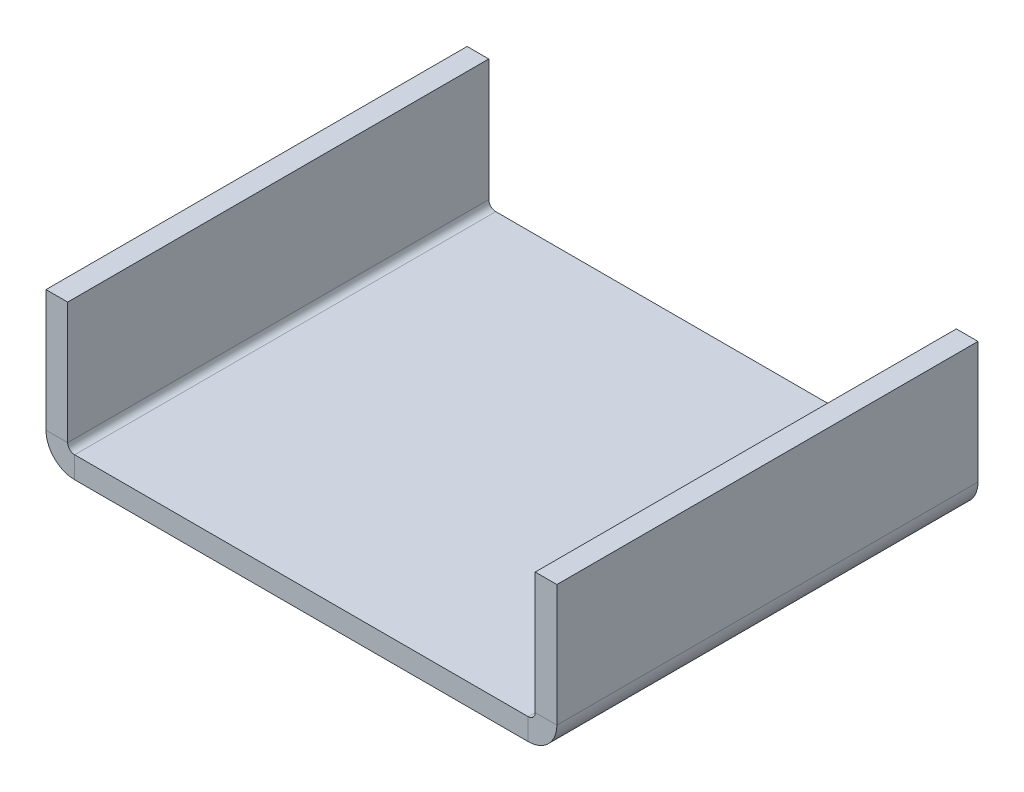
from build123d import *

# Parameters (mm, degrees)
SKETCH1_W                      = 53.9242
SKETCH1_H                      = 44.45
BASE_FLANGE2_DEPTH             = 2.286
EDGE_FLANGE1_STRIP_W           = 10.6172
EDGE_FLANGE1_STRIP_H           = 2.286
EDGE_FLANGE1_STRIP_CUT_DEPTH   = 44.45
EDGE_FLANGE1_STRIP_2_W         = 10.6172
EDGE_FLANGE1_STRIP_2_H         = 2.286
EDGE_FLANGE1_STRIP_CUT_2_DEPTH = 44.45
EDGE_FLANGE1_DEPTH             = 44.45
EDGE_FLANGE1_BEND_DEPTH        = 44.45


# Sheet-metal steps are written as plain solids
with BuildPart() as part:
    # Sketch1 → Base-Flange2 (new body)
    with BuildSketch(Plane(origin=(0, 0, 0), x_dir=(1, 0, 0), z_dir=(0, 1, 0))):
        Rectangle(SKETCH1_W, SKETCH1_H)
    extrude(amount=-BASE_FLANGE2_DEPTH)

    # Edge-Flange1 strip (across the edge) → Edge-Flange1 strip cut (cut)
    with BuildSketch(Plane(origin=(-26.9621, 0, -22.225), x_dir=(1, 0, 0), z_dir=(0, 0, 1))):
        with Locations((-2.286, -1.143)):
            Rectangle(EDGE_FLANGE1_STRIP_W, EDGE_FLANGE1_STRIP_H)
    extrude(amount=EDGE_FLANGE1_STRIP_CUT_DEPTH, mode=Mode.SUBTRACT)

    # Edge-Flange1 strip 2 (across the edge) → Edge-Flange1 strip cut 2 (cut)
    with BuildSketch(Plane(origin=(26.9621, 0, 22.225), x_dir=(-1, 0, 0), z_dir=(0, 0, -1))):
        with Locations((-2.286, -1.143)):
            Rectangle(EDGE_FLANGE1_STRIP_2_W, EDGE_FLANGE1_STRIP_2_H)
    extrude(amount=EDGE_FLANGE1_STRIP_CUT_2_DEPTH, mode=Mode.SUBTRACT)

    # Edge-Flange1 section (across the edge) → Edge-Flange1 (add)
    with BuildSketch(Plane(origin=(-26.9621, 0, -22.225), x_dir=(1, 0, 0), z_dir=(0, 0, 1))):
        with BuildLine():
            Line((0, 0.7366), (0, 13.589))
            Line((0, 13.589), (2.286, 13.589))
            Line((2.286, 13.589), (2.286, 0.7366))
            ThreePointArc((2.286, 0.7366), (2.501745145, 0.215745145), (3.0226, 0))
            Line((3.0226, 0), (3.0226, -2.286))
            ThreePointArc((3.0226, -2.286), (0.885299043, -1.400700957), (0, 0.7366))
        make_face()
    extrude(amount=EDGE_FLANGE1_DEPTH)

    # Edge-Flange1 section 2 (across the edge) → Edge-Flange1 bend (add)
    with BuildSketch(Plane(origin=(26.9621, 0, 22.225), x_dir=(-1, 0, 0), z_dir=(0, 0, -1))):
        with BuildLine():
            Line((0, 0.7366), (0, 13.589))
            Line((0, 13.589), (2.286, 13.589))
            Line((2.286, 13.589), (2.286, 0.7366))
            ThreePointArc((2.286, 0.7366), (2.501745145, 0.215745145), (3.0226, 0))
            Line((3.0226, 0), (3.0226, -2.286))
            ThreePointArc((3.0226, -2.286), (0.885299043, -1.400700957), (0, 0.7366))
        make_face()
    extrude(amount=EDGE_FLANGE1_BEND_DEPTH)


solid = part.part
